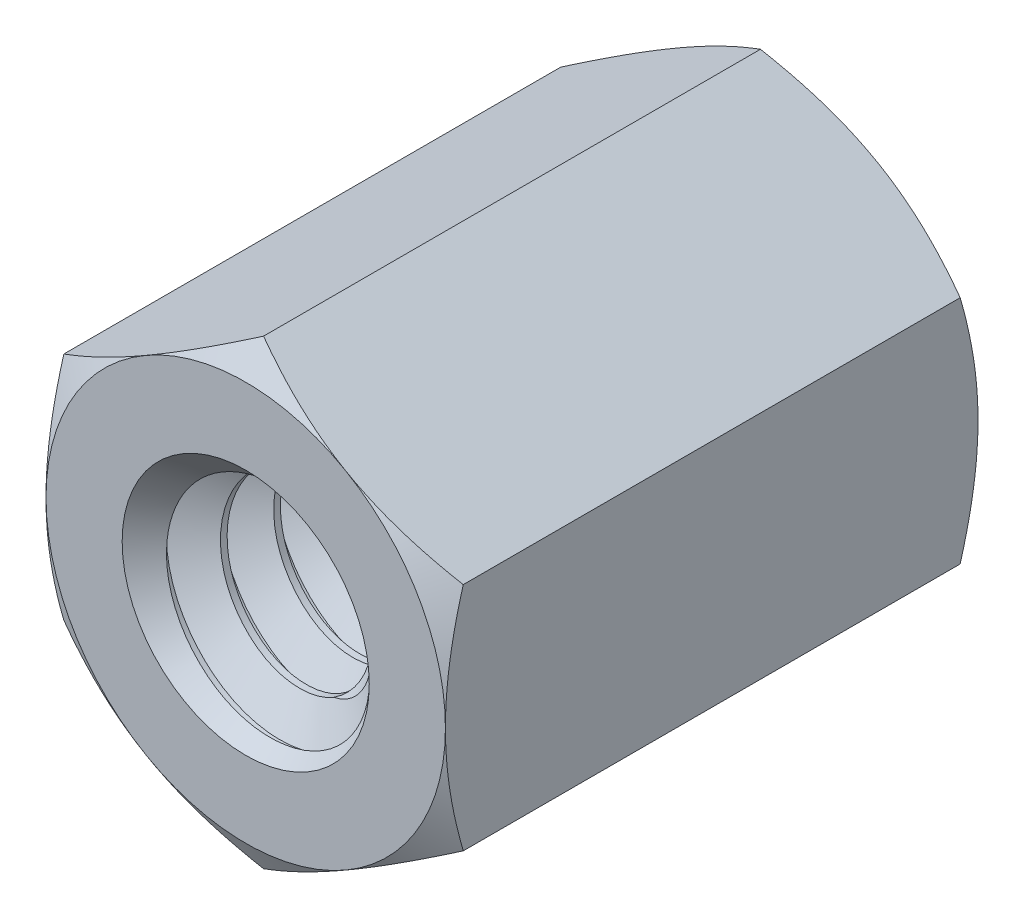
from build123d import *

# Parameters (mm, degrees)
EXTRUDE1_DEPTH          = 3.175
EXTRUDE1_DEPTH_BACK     = 3.175
SKETCH1_R               = 1.4224
SWEEP1_PITCH            = 0.635
EXTRUDE2_DEPTH          = 8.875497917
SKETCH8_OUTSIDE_W       = 39.524
SKETCH8_OUTSIDE_H       = 40.262
SKETCH8_OUTSIDE_R       = 2.38125
EXTRUDE4_DEPTH          = 8.875497917
EXTRUDE4_DRAFT          = -60
MIRROR1_COPY_1_SKETCH_W = 39.524
MIRROR1_COPY_1_SKETCH_H = 40.262
MIRROR1_COPY_1_SKETCH_R = 2.38125
MIRROR1_COPY_1_DEPTH    = 8.875497917
MIRROR1_COPY_1_DRAFT    = -60


with BuildPart() as part:
    # Sketch1 → Extrude1 (new, two sides: drawn at the far end of the back side and taken through both)
    with BuildSketch(Plane.XY.offset(-EXTRUDE1_DEPTH_BACK)):
        Polygon((0, 2.749630657), (-2.38125, 1.374815329), (-2.38125, -1.374815329), (0, -2.749630657), (2.38125, -1.374815329), (2.38125, 1.374815329), align=None)
        Circle(SKETCH1_R, mode=Mode.SUBTRACT)
    extrude(amount=EXTRUDE1_DEPTH + EXTRUDE1_DEPTH_BACK)

    # Sweep1: the profile of Sketch12 profile screwed along a right-hand helix of 11 turns, 6 arcs to a turn; built about Z, then put on its axis
    sweep1_z = Axis((0, 0, 0), (0, 0, 1))
    sweep1_corners = [(1.4227, 0, -0.555798205), (1.4227, 0, 0.000173205), (1.009955401, 0, -0.238125), (1.009955401, 0, -0.3175)]
    with BuildLine(mode=Mode.PRIVATE) as sweep1_profile:
        Line(sweep1_corners[0], sweep1_corners[1])
        Line(sweep1_corners[1], sweep1_corners[2])
        Line(sweep1_corners[2], sweep1_corners[3])
        Line(sweep1_corners[3], sweep1_corners[0])
    sweep1_cap = Face(sweep1_profile.wire())
    sweep1_turn_angles = [0, 30, 60, 90, 120, 150, 180, 210, 240, 270, 300, 330, 360]
    sweep1_turn_weights = [1, 0.8660254037844387, 1, 0.8660254037844387, 1, 0.8660254037844387, 1, 0.8660254037844387, 1, 0.8660254037844387, 1, 0.8660254037844387, 1]
    sweep1_turn_rails = [Edge.make_bspline([Vector(p[0], p[1], 0).rotate(sweep1_z, sweep1_turn_angles[k]) / sweep1_turn_weights[k] + Vector(0, 0, p[2] + SWEEP1_PITCH * sweep1_turn_angles[k] / 360) for k in range(13)], [0, 0, 0, 1, 1, 2, 2, 3, 3, 4, 4, 5, 5, 6, 6, 6], 2, sweep1_turn_weights) for p in sweep1_corners]
    sweep1_turn_sides = [Face.make_surface_from_curves(sweep1_turn_rails[p[0]], sweep1_turn_rails[p[1]]) for p in [(0, 1), (1, 2), (2, 3), (3, 0)]]
    sweep1 = Plane(origin=(0, 0, -3.175), x_dir=(0, 1, 0), z_dir=(0, 0, 1)) * Solid(Shell([*[p.moved(Location((0, 0, SWEEP1_PITCH * i))) for i in range(11) for p in sweep1_turn_sides], sweep1_cap, sweep1_cap.rotate(sweep1_z, 3960).moved(Location((0, 0, SWEEP1_PITCH * 3960 / 360)))]))
    add(sweep1)

    # Sketch6 → Extrude2 (cut, through all)
    with BuildSketch(Plane(origin=(0, 0, -3.175), x_dir=(-1, 0, 0), z_dir=(0, 0, -1))):
        Polygon((0, 2.749630657), (-2.38125, 1.374815329), (-2.38125, -1.374815329), (0, -2.749630657), (2.38125, -1.374815329), (2.38125, 1.374815329), align=None)
    extrude2 = extrude(amount=EXTRUDE2_DEPTH, mode=Mode.SUBTRACT)

    # Extrude3 cone 1 section (through the dimple's axis) → Extrude3 (revolve, cut)
    with BuildSketch(Plane(origin=(0, 0, -3.175), x_dir=(0, 1, 0), z_dir=(1, 0, 0))):
        Polygon((0, 0), (1.4732, 0), (0, 1.579813584), align=None)
    extrude3 = revolve(axis=Axis((0, 0, -3.175), (0, 0, 1)), mode=Mode.SUBTRACT)


with BuildPart() as extrude4_tool:
    # Sketch8 outside → Extrude4 (with draft: the straight prism first)
    with BuildSketch(Plane(origin=(0, 0, -3.175), x_dir=(-1, 0, 0), z_dir=(0, 0, -1))):
        Rectangle(SKETCH8_OUTSIDE_W, SKETCH8_OUTSIDE_H)
        Circle(SKETCH8_OUTSIDE_R, mode=Mode.SUBTRACT)
    extrude(amount=-EXTRUDE4_DEPTH)
    # Extrude4: the draft: its side faces are tilted about the plane it starts from
    extrude4_sides = [extrude4_tool.faces().sort_by_distance(p)[0] for p in [
        (0, -20.131, 1.262748958),
        (-19.762, 0, 1.262748958),
        (0, 20.131, 1.262748958),
        (19.762, 0, 1.262748958),
        (2.38125, 0, 1.262748958),
    ]]
    draft(extrude4_sides, Plane(origin=(0, 0, -3.175), x_dir=(-1, 0, 0), z_dir=(0, 0, -1)), EXTRUDE4_DRAFT)


with BuildPart() as part_1:
    add(part.part)

    # Extrude4: cut by extrude4_tool
    add(extrude4_tool.part, mode=Mode.SUBTRACT)

    # Mirror1: Extrude2, Extrude3 across plane
    add(extrude2.mirror(Plane.XY), mode=Mode.SUBTRACT)
    add(extrude3.mirror(Plane.XY), mode=Mode.SUBTRACT)


with BuildPart() as mirror1_copy_1_tool:
    # Mirror1 copy 1 sketch → Mirror1 copy 1 (with draft: the straight prism first)
    with BuildSketch(Plane(origin=(0, 0, 3.175), x_dir=(-1, 0, 0), z_dir=(0, 0, 1))):
        Rectangle(MIRROR1_COPY_1_SKETCH_W, MIRROR1_COPY_1_SKETCH_H)
        Circle(MIRROR1_COPY_1_SKETCH_R, mode=Mode.SUBTRACT)
    extrude(amount=-MIRROR1_COPY_1_DEPTH)
    # Mirror1 copy 1: the draft: its side faces are tilted about the plane it starts from
    mirror1_copy_1_sides = [mirror1_copy_1_tool.faces().sort_by_distance(p)[0] for p in [
        (0, -20.131, -1.262748958),
        (-19.762, 0, -1.262748958),
        (0, 20.131, -1.262748958),
        (19.762, 0, -1.262748958),
        (2.38125, 0, -1.262748958),
    ]]
    draft(mirror1_copy_1_sides, Plane(origin=(0, 0, 3.175), x_dir=(-1, 0, 0), z_dir=(0, 0, 1)), MIRROR1_COPY_1_DRAFT)


with BuildPart() as part_2:
    add(part_1.part)

    # Mirror1 copy 1: cut by mirror1_copy_1_tool
    add(mirror1_copy_1_tool.part, mode=Mode.SUBTRACT)


solid = part_2.part
